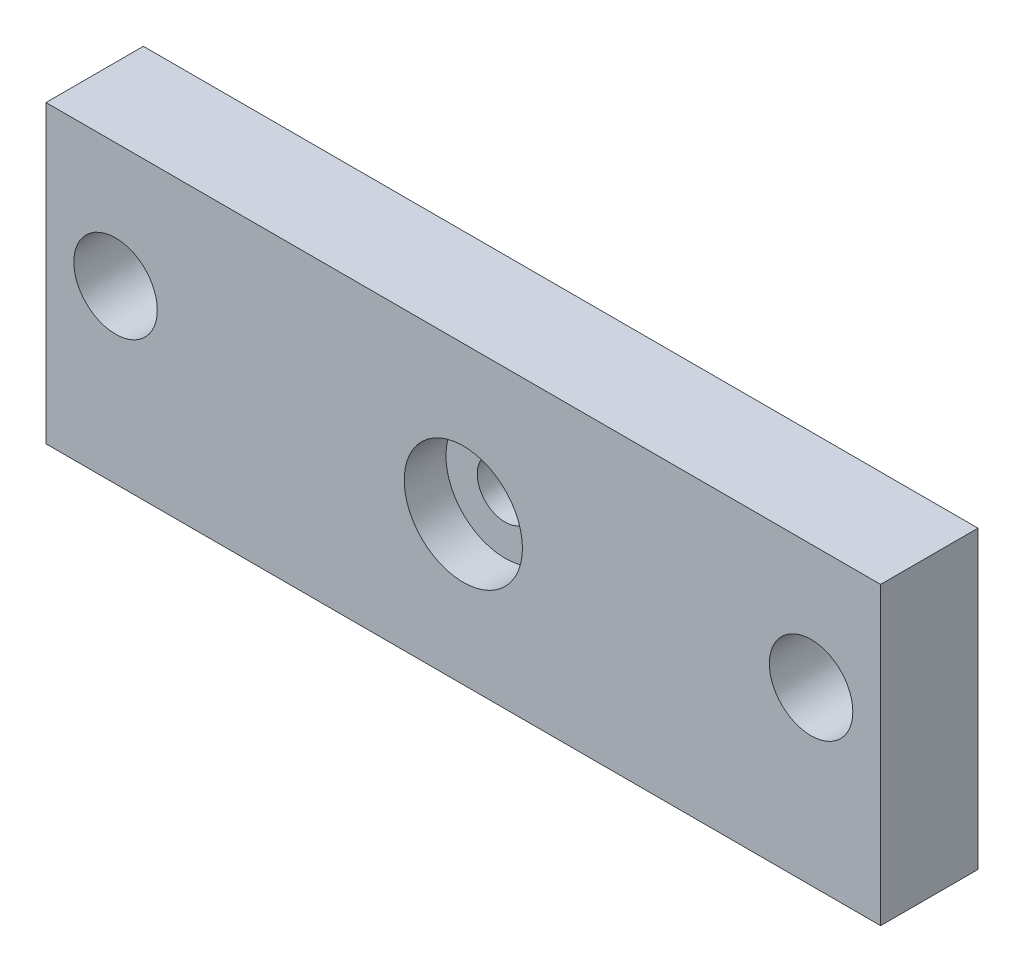
from build123d import *

# Parameters (mm, degrees)
SKETCH1_W           = 120
SKETCH1_H           = 42.5
BOSS_EXTRUDE1_DEPTH = 7
SKETCH2_R           = 8.5
CUT_EXTRUDE1_DEPTH  = 6
SKETCH3_R           = 4
CUT_EXTRUDE2_DEPTH  = 65.152649984
SKETCH5_R           = 6
CUT_EXTRUDE4_DEPTH  = 66.173326599
SKETCH6_R           = 2.1
SKETCH6_R_2         = 1.25
CUT_EXTRUDE5_DEPTH  = 10


with BuildPart() as part:
    # Sketch1 → Boss-Extrude1 (new, symmetric)
    with BuildSketch(Plane.XY):
        Rectangle(SKETCH1_W, SKETCH1_H)
    extrude(amount=BOSS_EXTRUDE1_DEPTH, both=True)

    # Sketch2 → Cut-Extrude1 (cut)
    with BuildSketch(Plane.XY.offset(7)):
        Circle(SKETCH2_R)
    extrude(amount=-CUT_EXTRUDE1_DEPTH, mode=Mode.SUBTRACT)

    # Sketch3 → Cut-Extrude2 (cut, through all)
    with BuildSketch(Plane.XY.offset(1)):
        Circle(SKETCH3_R)
    extrude(amount=-CUT_EXTRUDE2_DEPTH, mode=Mode.SUBTRACT)

    # Sketch5 → Cut-Extrude4 (cut, through all)
    with BuildSketch(Plane.XY.offset(7)):
        with Locations((-50, 3.4)):
            Circle(SKETCH5_R)
        with Locations((50, 3.4)):
            Circle(SKETCH5_R)
    extrude(amount=-CUT_EXTRUDE4_DEPTH, mode=Mode.SUBTRACT)

    # Sketch6 → Cut-Extrude5 (cut)
    with BuildSketch(Plane.XZ.offset(21.25)):
        with Locations((-50, 0)):
            Circle(SKETCH6_R)
        with Locations((-25, 0)):
            Circle(SKETCH6_R)
        with Locations((25, 0)):
            Circle(SKETCH6_R)
        with Locations((50, 0)):
            Circle(SKETCH6_R)
        with Locations((-37.5, 0)):
            Circle(SKETCH6_R_2)
        with Locations((37.5, 0)):
            Circle(SKETCH6_R_2)
    extrude(amount=-CUT_EXTRUDE5_DEPTH, mode=Mode.SUBTRACT)


solid = part.part
